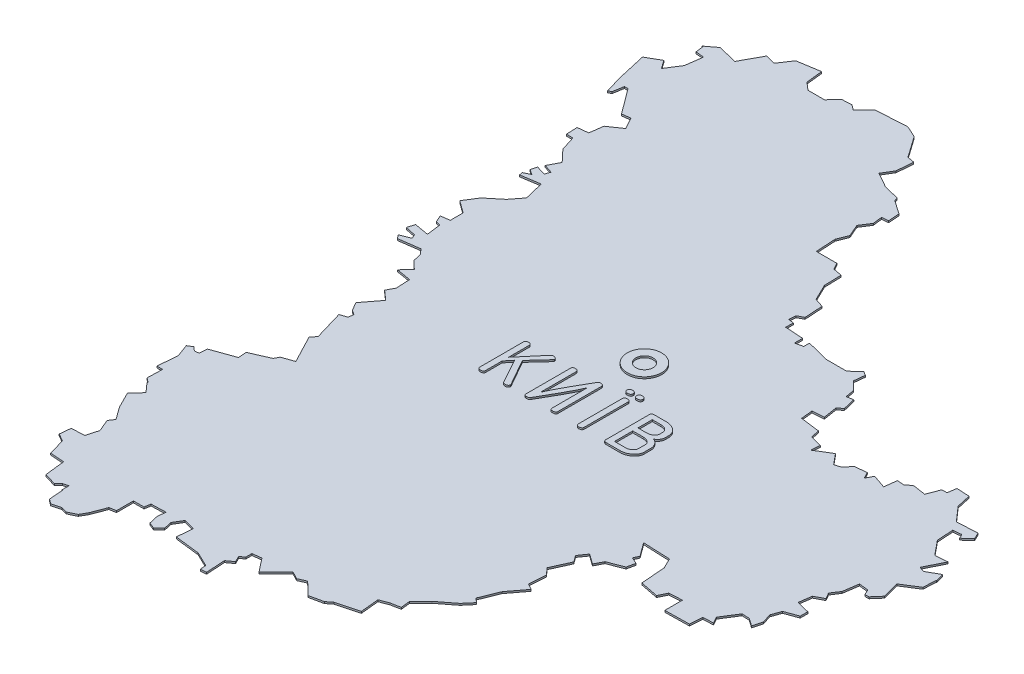
from build123d import *

# Parameters (mm, degrees)
EXTRUDE_1_DEPTH = 5
SKETCH_2_R      = 50
SKETCH_2_R_2    = 25
EXTRUDE_2_DEPTH = 10
SCALE_1_SCALE   = 0.05


with BuildPart() as part:
    # Эскиз1 → Бобышка-Вытянуть1 (new body)
    with BuildSketch(Plane(origin=(0, 0, 0), x_dir=(1, 0, 0), z_dir=(0, 1, 0))):
        Polygon((1323.13934, 6150.00802), (1334.82842, 6150.00802), (1356.22538, 6174.66634), (1343.2409, 6223.34544), (1389.35968, 6252.55036), (1391.26722, 6290.18808), (1392.61342, 6290.18808), (1386.05768, 6313.54592), (1350.40624, 6293.45198), (1334.82842, 6298.62596), (1362.06992, 6353.13944), (1326.39308, 6349.8984), (1292.01164, 6392.06748), (1288.7579, 6440.08618), (1312.77106, 6442.05722), (1319.25314, 6429.7179), (1341.96836, 6450.47732), (1332.89802, 6469.29618), (1273.15722, 6466.05514), (1236.18498, 6508.2293), (1227.1121, 6549.11568), (1190.08906, 6551.04608), (1186.20032, 6525.76038), (1171.28544, 6525.76038), (1157.66342, 6489.4333), (1125.24032, 6494.60982), (1118.10038, 6494.60982), (1104.4555, 6482.92582), (1083.66814, 6484.23138), (1079.1698, 6448.54946), (1039.55596, 6462.15116), (1029.16228, 6442.05722), (1019.429, 6460.85322), (985.0755, 6456.96956), (968.17688, 6436.84514), (950.64326, 6431.65338), (925.3347, 6462.15116), (880.55958, 6434.90458), (882.48998, 6460.85322), (848.77148, 6469.29618), (843.58734, 6494.60982), (787.12568, 6501.74468), (783.87194, 6535.48096), (817.61838, 6537.4393), (811.08804, 6578.3206), (824.78372, 6588.71428), (816.34584, 6624.39366), (797.51682, 6621.15516), (792.30728, 6648.40174), (768.29412, 6672.39966), (771.54786, 6702.90506), (759.85878, 6710.06532), (733.88982, 6686.03946), (672.90188, 6686.03946), (609.32568, 6702.90506), (609.32568, 6686.03946), (587.24292, 6680.85024), (587.24292, 6704.85324), (534.69286, 6708.09682), (534.69286, 6730.1618), (519.11758, 6732.1049), (521.07338, 6752.2344), (537.9212, 6761.3022), (534.69286, 6813.87004), (508.7239, 6822.31046), (485.37114, 6870.32408), (484.07574, 6919.66358), (458.10424, 6924.86296), (447.7131, 6943.67166), (388.0231, 6943.67166), (384.79476, 7001.41602), (397.11884, 7032.57674), (381.54356, 7068.2612), (400.37258, 7097.45596), (397.11884, 7124.73302), (415.92246, 7126.02334), (413.99206, 7158.46676), (374.40108, 7185.71842), (371.14988, 7196.09686), (327.0377, 7206.488), (282.26258, 7231.7864), (301.0662, 7262.94458), (304.95494, 7310.3232), (284.19298, 7314.2094), (241.3508, 7375.2075), (207.6069, 7390.78278), (118.7196, 7385.58594), (86.29396, 7353.1476), (70.69328, 7364.82652), (42.13098, 7363.50826), (18.11782, 7337.57232), (-29.8831, 7337.57232), (-51.94046, 7356.3861), (-57.15, 7404.4175), (-122.02414, 7394.0162), (-147.3327, 7356.3861), (-176.53, 7363.50826), (-209.0039, 7303.83858), (-265.4427, 7317.4606), (-294.63746, 7295.39562), (-295.3004, 7294.73268), (-292.70706, 7295.39562), (-289.45586, 7271.39008), (-265.4427, 7269.42666), (-271.94764, 7220.09986), (-297.8912, 7179.23888), (-314.76442, 7203.24696), (-354.35286, 7180.52666), (-335.52384, 7097.45596), (-319.94856, 7044.26582), (-311.51068, 7049.44742), (-306.32654, 7079.94266), (-295.9354, 7079.94266), (-241.427, 7006.62556), (-217.43924, 7009.87676), (-198.61022, 6976.10492), (-236.2454, 6950.18676), (-241.427, 6911.22316), (-271.94764, 6907.96434), (-270.6243, 6875.53108), (-251.82068, 6875.53108), (-238.2012, 6832.70668), (-205.7527, 6798.28206), (-222.62338, 6765.86912), (-197.31482, 6757.42616), (-202.49896, 6742.49604), (-229.76586, 6750.9263), (-234.31246, 6733.41046), (-219.37218, 6723.67718), (-238.2012, 6714.59922), (-236.2454, 6704.85324), (-181.73954, 6713.2962), (-168.11752, 6656.83962), (-193.42608, 6624.39366), (-234.31246, 6590.64722), (-258.30022, 6553.01204), (-222.62338, 6527.04308), (-222.62338, 6489.4333), (-248.56948, 6486.17194), (-239.4966, 6466.05514), (-225.85172, 6462.15116), (-220.66758, 6421.2851), (-262.21436, 6428.39456), (-268.6939, 6407.6326), (-238.2012, 6401.16576), (-232.99166, 6388.8239), (-262.21436, 6377.16022), (-253.11608, 6366.76908), (-193.42608, 6375.20696), (-179.7812, 6359.63676), (-174.59706, 6336.26368), (-151.2443, 6313.54592), (-174.59706, 6288.25006), (-132.41528, 6281.11012), (-130.48488, 6240.2212), (-142.14856, 6218.15876), (-114.90706, 6194.14814), (-152.51684, 6144.82388), (-137.62482, 6119.51786), (-125.30074, 6112.38554), (-127.23114, 6096.81026), (-147.3327, 6090.32056), (-122.02414, 6004.6489), (-133.71068, 5989.73402), (-91.5543, 5909.26428), (-125.30074, 5897.57774), (-132.41528, 5883.95318), (-186.94654, 5859.95018), (-184.99074, 5835.93702), (-251.82068, 5811.9137), (-253.11608, 5789.8538), (-265.4427, 5787.91578), (-277.12924, 5798.29676), (-290.75126, 5789.8538), (-277.12924, 5752.21608), (-282.31338, 5695.76712), (-265.4427, 5695.76712), (-266.7381, 5651.62954), (-253.11608, 5641.26126), (-255.70942, 5640.62626), (-231.06126, 5612.69896), (-257.00482, 5584.79706), (-232.99166, 5537.40574), (-207.0481, 5501.73144), (-217.43924, 5486.15362), (-202.49896, 5450.45138), (-212.23224, 5416.06994), (-249.89028, 5414.11414), (-253.11608, 5382.32604), (-231.06126, 5369.99942), (-217.43924, 5321.9731), (-176.53, 5318.7219), (-174.59706, 5298.62288), (-170.07586, 5260.9877), (-135.66902, 5250.59656), (-123.97994, 5262.2577), (-108.40212, 5266.14644), (-108.40212, 5245.38702), (-106.47172, 5245.38702), (-103.21798, 5204.52604), (-89.5731, 5194.13236), (-63.60414, 5201.2723), (-46.78172, 5196.08816), (-22.74316, 5207.75184), (-11.05408, 5228.5392), (4.49834, 5269.40018), (23.32736, 5272.65138), (23.32736, 5321.9731), (53.82006, 5321.9731), (57.07126, 5339.50672), (99.89058, 5340.77926), (96.66224, 5318.7219), (103.14178, 5290.185), (120.6754, 5283.01966), (137.54862, 5298.62288), (132.33908, 5321.9731), (147.9169, 5347.9446), (180.3654, 5339.50672), (176.47666, 5293.43874), (248.49074, 5285.00086), (291.33546, 5264.24144), (292.63086, 5247.34282), (309.50408, 5248.63822), (306.27574, 5303.80448), (325.07936, 5317.4265), (316.64402, 5334.29972), (328.3331, 5344.69086), (328.3331, 5361.53868), (354.30206, 5364.81782), (384.79476, 5325.88724), (434.09108, 5375.20896), (456.80884, 5363.49448), (478.8916, 5373.25316), (515.86384, 5337.52552), (554.81982, 5345.98626), (570.3697, 5358.31288), (633.33884, 5375.20896), (628.1293, 5428.39402), (654.09826, 5438.1273), (681.33976, 5443.33684), (678.11142, 5470.5758), (710.58786, 5503.02684), (756.63044, 5538.72908), (778.6878, 5564.67264), (766.33832, 5575.06632), (788.39568, 5629.57218), (824.78372, 5677.5731), (807.2755, 5687.30638), (811.08804, 5735.35302), (793.60522, 5755.45966), (817.61838, 5808.69298), (804.02176, 5827.48898), (820.86958, 5851.50976), (850.09228, 5830.74272), (862.41636, 5854.74318), (906.52854, 5871.61386), (911.73808, 5895.64226), (892.88366, 5904.07506), (899.3886, 5919.65542), (870.82884, 5958.60378), (949.34786, 5955.33988), (964.28814, 5924.8294), (969.47228, 5854.74318), (1022.65734, 5844.37236), (1034.39722, 5868.3906), (1072.02986, 5870.33624), (1072.02986, 5819.05872), (1142.08814, 5820.35666), (1145.31394, 5856.7066), (1174.53664, 5857.99438), (1164.1455, 5876.82848), (1193.34026, 5922.89138), (1215.44842, 5921.58328), (1237.48038, 5906.02578), (1244.64572, 5933.2749), (1236.18498, 5960.5418), (1245.89032, 5987.78584), (1283.5509, 6001.41548), (1283.5509, 6023.48046), (1245.89032, 6032.55842), (1251.09986, 6069.54082), (1277.04342, 6083.18062), (1266.70308, 6100.71932), (1282.25296, 6124.7274), (1288.7579, 6168.84212), (1316.0248, 6165.596), align=None)
    extrude(amount=EXTRUDE_1_DEPTH)

    # Эскиз2 → Бобышка-Вытянуть2 (add)
    # profile 1 of 7: a face of its own
    with BuildSketch(Plane(origin=(0, 0, 0), x_dir=(1, 0, 0), z_dir=(0, 1, 0))):
        with Locations((423.771289097, 6408.067162755)):
            Circle(SKETCH_2_R)
        with Locations((423.771289097, 6408.067162755)):
            Circle(SKETCH_2_R_2, mode=Mode.SUBTRACT)
    # profile 2 of 7: a face of its own
    with BuildSketch(Plane(origin=(0, 0, 0), x_dir=(1, 0, 0), z_dir=(0, 1, 0))):
        with BuildLine():
            Line((212.100996902, 6205.640563709), (212.100996902, 6158.165901547))
            add(Edge.make_bspline(
                [(212.100996902, 6158.165901547), (212.076151037, 6157.630130272), (212.028702129, 6156.606951506), (211.570733248, 6155.176310008), (210.823160978, 6153.95011345), (209.727178033, 6152.985301335), (208.3770608, 6152.204739616), (206.713722067, 6151.685071424), (204.769287254, 6151.410763775), (203.381465112, 6151.362882504), (202.641537443, 6151.337354249)],
                knots=[0, 0, 0, 0, 0.966526808, 1.845805764, 2.686487088, 3.531690263, 4.457941251, 5.489333743, 6.661419661, 8, 8, 8, 8], degree=3))
            add(Edge.make_bspline(
                [(202.641537443, 6151.337354249), (202.049390358, 6151.363162041), (200.935803217, 6151.411695972), (199.368110983, 6151.685685858), (198.039454345, 6152.222993338), (196.940831304, 6152.973129919), (196.076068853, 6153.954096971), (195.49620751, 6155.162107707), (195.127098661, 6156.567866292), (195.092430479, 6157.572055214), (195.073969875, 6158.106779925)],
                knots=[0, 0, 0, 0, 1.22289028, 2.299757822, 3.266537475, 4.157864275, 5.022578284, 5.932048079, 6.898827733, 8, 8, 8, 8], degree=3))
            Line((195.073969875, 6158.106779925), (195.073969875, 6284.567928574))
            add(Edge.make_bspline(
                [(195.073969875, 6284.567928574), (195.092430479, 6285.102653284), (195.127098661, 6286.106842207), (195.49620751, 6287.512600792), (196.076068853, 6288.720611528), (196.940831304, 6289.701578579), (198.039454345, 6290.451715161), (199.368110983, 6290.989022641), (200.935803217, 6291.263012527), (202.049390358, 6291.311546457), (202.641537443, 6291.337354249)],
                knots=[0, 0, 0, 0, 1.101172267, 2.067951921, 2.977421716, 3.842135725, 4.733462525, 5.700242178, 6.77710972, 8, 8, 8, 8], degree=3))
            add(Edge.make_bspline(
                [(202.641537443, 6291.337354249), (203.381103556, 6291.311191), (204.768247555, 6291.262118723), (206.717109001, 6290.995585475), (208.357352893, 6290.454385614), (209.744095686, 6289.758227886), (210.810970457, 6288.782939572), (211.572351704, 6287.591050264), (212.028341152, 6286.185989365), (212.076019574, 6285.182375115), (212.100996902, 6284.656611006)],
                knots=[0, 0, 0, 0, 1.349898262, 2.531894363, 3.572007453, 4.488635547, 5.340985057, 6.173587819, 7.043196157, 8, 8, 8, 8], degree=3))
            Line((212.100996902, 6284.656611006), (212.100996902, 6224.234313709))
            Line((212.100996902, 6224.234313709), (268.207415821, 6290.509651547))
            add(Edge.make_bspline(
                [(268.207415821, 6290.509651547), (268.614488581, 6290.923876385), (269.416229371, 6291.739703388), (270.906877501, 6292.611583145), (272.578211618, 6293.129595801), (273.751186942, 6293.195342181), (274.35606447, 6293.229246141)],
                knots=[0, 0, 0, 0, 1.001638502, 1.972754074, 2.954593947, 4, 4, 4, 4], degree=3))
            add(Edge.make_bspline(
                [(274.35606447, 6293.229246141), (275.029052882, 6293.20325954), (276.341249035, 6293.152590737), (278.214699392, 6292.689295054), (279.954093924, 6291.985754903), (281.436137429, 6290.948787941), (282.699693437, 6289.830503342), (283.626369837, 6288.673994946), (284.274717756, 6287.51652025), (284.343876896, 6286.703508673), (284.377179335, 6286.312016412)],
                knots=[0, 0, 0, 0, 1.21950062, 2.377788377, 3.483948434, 4.605045631, 5.643332121, 6.534384309, 7.294257033, 8, 8, 8, 8], degree=3))
            add(Edge.make_bspline(
                [(284.377179335, 6286.312016412), (284.288442316, 6285.698589957), (284.095398051, 6284.36410227), (283.203624345, 6283.34495426), (282.721773929, 6282.794279925)],
                knots=[0, 0, 0, 0, 0.919343747, 2, 2, 2, 2], degree=3))
            Line((282.721773929, 6282.794279925), (240.302010416, 6236.590732628))
            Line((240.302010416, 6236.590732628), (283.165186091, 6161.121982628))
            add(Edge.make_bspline(
                [(283.165186091, 6161.121982628), (283.485550423, 6160.545152222), (284.037455072, 6159.551423046), (284.19347931, 6158.429609726), (284.258936091, 6157.958975871)],
                knots=[0, 0, 0, 0, 1.160940868, 2, 2, 2, 2], degree=3))
            add(Edge.make_bspline(
                [(284.258936091, 6157.958975871), (284.234595257, 6157.443160709), (284.187561467, 6156.446451194), (283.71064667, 6155.045588383), (282.86342853, 6153.886358729), (281.751463934, 6152.915054274), (280.289774247, 6152.209266734), (278.546631297, 6151.682591099), (276.482570232, 6151.412381991), (275.016865592, 6151.363392768), (274.237821227, 6151.337354249)],
                knots=[0, 0, 0, 0, 0.908999758, 1.756460018, 2.56759263, 3.418796028, 4.337074916, 5.410419897, 6.623598691, 8, 8, 8, 8], degree=3))
            add(Edge.make_bspline(
                [(274.237821227, 6151.337354249), (273.534244662, 6151.365978734), (272.231010639, 6151.418999832), (270.453840762, 6151.935566921), (269.053833858, 6152.872628796), (268.50543111, 6153.766959525), (268.236976632, 6154.204752898)],
                knots=[0, 0, 0, 0, 1.200457517, 2.223606012, 3.130418436, 4, 4, 4, 4], degree=3))
            Line((268.236976632, 6154.204752898), (228.536807713, 6225.948840736))
            Line((228.536807713, 6225.948840736), (212.100996902, 6205.640563709))
        make_face()
    # profile 3 of 7: a face of its own
    with BuildSketch(Plane(origin=(0, 0, 0), x_dir=(1, 0, 0), z_dir=(0, 1, 0))):
        with BuildLine():
            add(Edge.make_bspline(
                [(420.587483389, 6159.969111006), (420.561164492, 6159.4437072), (420.510454683, 6158.431387916), (420.065824983, 6157.012999699), (419.297951191, 6155.811422301), (418.222933333, 6154.842511655), (416.853364877, 6154.10439863), (415.201978809, 6153.574000663), (413.255230319, 6153.303565123), (411.867762623, 6153.25509066), (411.128023929, 6153.229246141)],
                knots=[0, 0, 0, 0, 0.953740082, 1.837614163, 2.667550865, 3.517171085, 4.439430397, 5.476212962, 6.654424219, 8, 8, 8, 8], degree=3))
            add(Edge.make_bspline(
                [(411.128023929, 6153.229246141), (410.535886071, 6153.255058462), (409.422316283, 6153.30360091), (407.854509644, 6153.57753464), (406.526224421, 6154.115024432), (405.426359207, 6154.864551281), (404.57195537, 6155.8410367), (403.975206825, 6157.030396449), (403.617618998, 6158.421362706), (403.580205567, 6159.415029318), (403.560456362, 6159.939550195)],
                knots=[0, 0, 0, 0, 1.228791976, 2.310856505, 3.282301858, 4.177930221, 5.04681736, 5.942445723, 6.913891076, 8, 8, 8, 8], degree=3))
            Line((403.560456362, 6159.939550195), (403.560456362, 6261.717421817))
            add(Edge.make_bspline(
                [(403.560456362, 6261.717421817), (403.033910823, 6260.483268572), (401.920746483, 6257.874158281), (400.039323907, 6253.79273387), (397.926534894, 6249.311256353), (395.511007167, 6244.453376438), (392.858342494, 6239.197255452), (389.930010163, 6233.551665946), (386.729151179, 6227.530768057), (383.305363082, 6221.092625987), (379.569388631, 6214.290700867), (375.633811496, 6207.062506883), (371.333775671, 6199.500447731), (366.877344885, 6191.492784135), (362.102448663, 6183.125858504), (357.070573033, 6174.369752859), (351.788168305, 6165.210494191), (348.156243694, 6158.982241078), (346.301165821, 6155.801036682)],
                knots=[0, 0, 0, 0, 0.534634628, 1.1302654, 1.790641929, 2.508823085, 3.291972686, 4.136661157, 5.042962484, 6.009079317, 7.042220393, 8.135217324, 9.288472575, 10.508460132, 11.78685178, 13.127093989, 14.532606002, 16, 16, 16, 16], degree=3))
            add(Edge.make_bspline(
                [(346.301165821, 6155.801036682), (345.84906249, 6155.11283426), (344.950095667, 6153.744405624), (342.816912935, 6152.323628558), (340.220878932, 6151.440139488), (338.308516205, 6151.373184889), (337.285118524, 6151.337354249)],
                knots=[0, 0, 0, 0, 0.92554952, 1.840371998, 2.844278725, 4, 4, 4, 4], degree=3))
            add(Edge.make_bspline(
                [(337.285118524, 6151.337354249), (336.691670776, 6151.355907263), (335.581164805, 6151.390625117), (334.027185181, 6151.753534445), (332.711702957, 6152.33381325), (331.616288619, 6153.167113216), (330.787646736, 6154.253767325), (330.180299256, 6155.573338131), (329.837134396, 6157.123930124), (329.797503896, 6158.233176648), (329.776672578, 6158.816239384)],
                knots=[0, 0, 0, 0, 1.171630376, 2.192446653, 3.134147218, 3.995415972, 4.884019595, 5.808017826, 6.847809664, 8, 8, 8, 8], degree=3))
            Line((329.776672578, 6158.816239384), (329.776672578, 6286.430259655))
            add(Edge.make_bspline(
                [(329.776672578, 6286.430259655), (329.797058255, 6286.964268072), (329.835706174, 6287.976660972), (330.183636085, 6289.391852116), (330.797901582, 6290.58947479), (331.631224018, 6291.593977027), (332.743946679, 6292.342211722), (334.070259446, 6292.88134666), (335.638673653, 6293.154773642), (336.752151289, 6293.20339295), (337.344240145, 6293.229246141)],
                knots=[0, 0, 0, 0, 1.098843442, 2.08322802, 2.972669788, 3.850929026, 4.740370794, 5.705105844, 6.779695961, 8, 8, 8, 8], degree=3))
            add(Edge.make_bspline(
                [(337.344240145, 6293.229246141), (338.083919865, 6293.203338844), (339.471276945, 6293.154746634), (341.418747483, 6292.885079703), (343.067860681, 6292.352262295), (344.450600972, 6291.61863933), (345.50496989, 6290.617301), (346.283590455, 6289.417599704), (346.729232214, 6287.98755801), (346.778107066, 6286.965463287), (346.803699605, 6286.430259655)],
                knots=[0, 0, 0, 0, 1.340544031, 2.514349394, 3.547254935, 4.466065479, 5.324653274, 6.151486447, 7.032055301, 8, 8, 8, 8], degree=3))
            Line((346.803699605, 6286.430259655), (346.803699605, 6182.849178574))
            add(Edge.make_bspline(
                [(346.803699605, 6182.849178574), (347.320526975, 6184.083217194), (348.413244475, 6186.692319719), (350.255925546, 6190.768433224), (352.364889561, 6195.237593383), (354.715998547, 6200.102693985), (357.367471483, 6205.344783143), (360.254702756, 6210.986265505), (363.430977027, 6217.019793058), (366.842685161, 6223.453815337), (370.558695517, 6230.261381777), (374.507837822, 6237.471064455), (378.745348153, 6245.057059097), (383.198015109, 6253.055815741), (387.966051887, 6261.411206554), (392.997988373, 6270.167279425), (398.280375923, 6279.326547345), (401.912302936, 6285.554799163), (403.767382037, 6288.736002898)],
                knots=[0, 0, 0, 0, 0.533796669, 1.128595342, 1.784614138, 2.505550971, 3.284458494, 4.128465136, 5.034135491, 6.005002577, 7.034180805, 8.12862722, 9.284923427, 10.501177496, 11.78126449, 13.123284068, 14.53066001, 16, 16, 16, 16], degree=3))
            add(Edge.make_bspline(
                [(403.767382037, 6288.736002898), (404.192389427, 6289.428544738), (405.005072385, 6290.752796889), (406.817192954, 6292.180125393), (408.895952686, 6293.110423143), (410.408230376, 6293.18885101), (411.187145551, 6293.229246141)],
                knots=[0, 0, 0, 0, 1.059650509, 2.02622338, 2.98338475, 4, 4, 4, 4], degree=3))
            add(Edge.make_bspline(
                [(411.187145551, 6293.229246141), (411.928327268, 6293.211759583), (413.312092494, 6293.179112674), (415.238112364, 6292.80847127), (416.902134914, 6292.277832869), (418.258874408, 6291.441191103), (419.311384004, 6290.361597463), (420.066302338, 6289.054645656), (420.515623909, 6287.503235336), (420.562685455, 6286.393978479), (420.587483389, 6285.809482628)],
                knots=[0, 0, 0, 0, 1.29965344, 2.426416082, 3.433331493, 4.350449838, 5.194812866, 6.055508021, 6.975397369, 8, 8, 8, 8], degree=3))
            Line((420.587483389, 6285.809482628), (420.587483389, 6159.969111006))
        make_face()
    # profile 4 of 7: a face of its own
    with BuildSketch(Plane(origin=(0, 0, 0), x_dir=(1, 0, 0), z_dir=(0, 1, 0))):
        with BuildLine():
            add(Edge.make_bspline(
                [(467.02160501, 6314.040056952), (467.039110958, 6314.633491471), (467.072221023, 6315.755890344), (467.456463581, 6317.329660328), (468.116127381, 6318.660860146), (469.026028707, 6319.7704453), (470.215993612, 6320.605359891), (471.646726189, 6321.201553852), (473.331091282, 6321.551135526), (474.538145173, 6321.588006424), (475.180388794, 6321.60762452)],
                knots=[0, 0, 0, 0, 1.115458338, 2.109734338, 3.022263655, 3.891534895, 4.782118321, 5.729611698, 6.79198235, 8, 8, 8, 8], degree=3))
            add(Edge.make_bspline(
                [(475.180388794, 6321.60762452), (475.960484813, 6321.588221739), (477.431272935, 6321.55163986), (479.49132336, 6321.197225804), (481.256545986, 6320.633388286), (482.702122333, 6319.784051194), (483.833238418, 6318.692281125), (484.652806765, 6317.353784238), (485.135930712, 6315.766884403), (485.178920585, 6314.634769761), (485.201503659, 6314.040056952)],
                knots=[0, 0, 0, 0, 1.307446989, 2.465052319, 3.494757347, 4.399019533, 5.252295706, 6.105571879, 7.004835174, 8, 8, 8, 8], degree=3))
            add(Edge.make_bspline(
                [(485.201503659, 6314.040056952), (485.178920585, 6313.445344143), (485.135930712, 6312.313229501), (484.652806765, 6310.726329666), (483.833238418, 6309.387832779), (482.702122333, 6308.29606271), (481.256545986, 6307.446725618), (479.49132336, 6306.8828881), (477.431272935, 6306.528474044), (475.960484813, 6306.491892165), (475.180388794, 6306.472489384)],
                knots=[0, 0, 0, 0, 0.995164826, 1.894428121, 2.747704294, 3.600980467, 4.505242653, 5.534947681, 6.692553011, 8, 8, 8, 8], degree=3))
            add(Edge.make_bspline(
                [(475.180388794, 6306.472489384), (474.538145173, 6306.49210748), (473.331091282, 6306.528978378), (471.646726189, 6306.878560052), (470.215993612, 6307.474754013), (469.026028707, 6308.309668605), (468.116127381, 6309.419253758), (467.456463581, 6310.750453576), (467.072221023, 6312.32422356), (467.039110958, 6313.446622433), (467.02160501, 6314.040056952)],
                knots=[0, 0, 0, 0, 1.20801765, 2.270388302, 3.217881679, 4.108465105, 4.977736345, 5.890265662, 6.884541662, 8, 8, 8, 8], degree=3))
        make_face()
    # profile 5 of 7: a face of its own
    with BuildSketch(Plane(origin=(0, 0, 0), x_dir=(1, 0, 0), z_dir=(0, 1, 0))):
        with BuildLine():
            add(Edge.make_bspline(
                [(495.252179335, 6314.040056952), (495.269655166, 6314.63353636), (495.30270827, 6315.756020134), (495.687332225, 6317.329221638), (496.345715162, 6318.662330612), (497.255005738, 6319.758984095), (498.426292255, 6320.622814516), (499.871752316, 6321.192883317), (501.550956167, 6321.551139458), (502.748713232, 6321.588100601), (503.381402308, 6321.60762452)],
                knots=[0, 0, 0, 0, 1.117752497, 2.114073421, 3.028479535, 3.899538602, 4.77692123, 5.743494502, 6.808050129, 8, 8, 8, 8], degree=3))
            add(Edge.make_bspline(
                [(503.381402308, 6321.60762452), (504.161498327, 6321.588221739), (505.632286449, 6321.55163986), (507.692336873, 6321.197225804), (509.4575595, 6320.633388286), (510.903135847, 6319.784051194), (512.034251932, 6318.692281125), (512.853820279, 6317.353784238), (513.336944225, 6315.766884403), (513.379934099, 6314.634769761), (513.402517172, 6314.040056952)],
                knots=[0, 0, 0, 0, 1.307446989, 2.465052319, 3.494757347, 4.399019533, 5.252295706, 6.105571879, 7.004835174, 8, 8, 8, 8], degree=3))
            add(Edge.make_bspline(
                [(513.402517172, 6314.040056952), (513.379934099, 6313.445344143), (513.336944225, 6312.313229501), (512.853820279, 6310.726329666), (512.034251932, 6309.387832779), (510.903135847, 6308.29606271), (509.4575595, 6307.446725618), (507.692336873, 6306.8828881), (505.632286449, 6306.528474044), (504.161498327, 6306.491892165), (503.381402308, 6306.472489384)],
                knots=[0, 0, 0, 0, 0.995164826, 1.894428121, 2.747704294, 3.600980467, 4.505242653, 5.534947681, 6.692553011, 8, 8, 8, 8], degree=3))
            add(Edge.make_bspline(
                [(503.381402308, 6306.472489384), (502.748713232, 6306.492013303), (501.550956167, 6306.528974447), (499.871752316, 6306.887230587), (498.426292255, 6307.457299388), (497.255005738, 6308.321129809), (496.345715162, 6309.417783293), (495.687332225, 6310.750892266), (495.30270827, 6312.32409377), (495.269655166, 6313.446577544), (495.252179335, 6314.040056952)],
                knots=[0, 0, 0, 0, 1.191949871, 2.256505498, 3.22307877, 4.100461398, 4.971520465, 5.885926579, 6.882247503, 8, 8, 8, 8], degree=3))
        make_face()
    # profile 6 of 7: a face of its own
    with BuildSketch(Plane(origin=(0, 0, 0), x_dir=(1, 0, 0), z_dir=(0, 1, 0))):
        with BuildLine():
            add(Edge.make_bspline(
                [(498.533429335, 6158.136340736), (498.508020227, 6157.600920536), (498.459495678, 6156.578412228), (498.011456251, 6155.151201336), (497.244984659, 6153.947185408), (496.160891099, 6152.984515019), (494.80909362, 6152.20498498), (493.146282347, 6151.684992925), (491.20168044, 6151.410787872), (489.813883897, 6151.362890884), (489.073969875, 6151.337354249)],
                knots=[0, 0, 0, 0, 0.968349646, 1.849286893, 2.676465977, 3.523263178, 4.451261044, 5.484598709, 6.658895142, 8, 8, 8, 8], degree=3))
            add(Edge.make_bspline(
                [(489.073969875, 6151.337354249), (488.481661061, 6151.362925637), (487.367769773, 6151.411014988), (485.802082811, 6151.687936032), (484.461568898, 6152.217841326), (483.381097616, 6153.005036179), (482.516935627, 6153.976861083), (481.915555099, 6155.176844307), (481.564788003, 6156.589319114), (481.526564249, 6157.602118113), (481.506402308, 6158.136340736)],
                knots=[0, 0, 0, 0, 1.220860227, 2.29594012, 3.261114875, 4.162696787, 5.025975332, 5.915822489, 6.900655729, 8, 8, 8, 8], degree=3))
            Line((481.506402308, 6158.136340736), (481.506402308, 6285.425192087))
            add(Edge.make_bspline(
                [(481.506402308, 6285.425192087), (481.526787984, 6285.959200505), (481.565435904, 6286.971593405), (481.913365814, 6288.386784549), (482.527631311, 6289.584407222), (483.360953748, 6290.588909459), (484.473676409, 6291.337144155), (485.799989175, 6291.876279093), (487.368403383, 6292.149706074), (488.481881019, 6292.198325382), (489.073969875, 6292.224178574)],
                knots=[0, 0, 0, 0, 1.098843442, 2.08322802, 2.972669788, 3.850929026, 4.740370794, 5.705105844, 6.779695961, 8, 8, 8, 8], degree=3))
            add(Edge.make_bspline(
                [(489.073969875, 6292.224178574), (489.813649594, 6292.198271276), (491.201006675, 6292.149679066), (493.148477212, 6291.880012136), (494.79759041, 6291.347194727), (496.180330702, 6290.613571763), (497.23469962, 6289.612233432), (498.013320185, 6288.412532136), (498.458961943, 6286.982490442), (498.507836796, 6285.96039572), (498.533429335, 6285.425192087)],
                knots=[0, 0, 0, 0, 1.340544031, 2.514349394, 3.547254935, 4.466065479, 5.324653274, 6.151486447, 7.032055301, 8, 8, 8, 8], degree=3))
            Line((498.533429335, 6285.425192087), (498.533429335, 6158.136340736))
        make_face()
    # profile 7 of 7: a face of its own
    with BuildSketch(Plane(origin=(0, 0, 0), x_dir=(1, 0, 0), z_dir=(0, 1, 0))):
        with BuildLine():
            add(Edge.make_bspline(
                [(569.030050956, 6151.337354249), (568.428336981, 6151.363776961), (567.295738061, 6151.41351211), (565.704882581, 6151.678935761), (564.366004249, 6152.232637254), (563.240927002, 6152.961425545), (562.381984723, 6153.962999435), (561.758593878, 6155.15284569), (561.400051844, 6156.569316501), (561.363632978, 6157.572559117), (561.344240145, 6158.106779925)],
                knots=[0, 0, 0, 0, 1.232960821, 2.320787205, 3.279617941, 4.180256019, 5.037860301, 5.949050899, 6.907881634, 8, 8, 8, 8], degree=3))
            Line((561.344240145, 6158.106779925), (561.344240145, 6284.567928574))
            add(Edge.make_bspline(
                [(561.344240145, 6284.567928574), (561.363630603, 6285.102155355), (561.400045008, 6286.105409189), (561.758616895, 6287.521804922), (562.381904863, 6288.711909904), (563.241212111, 6289.712565932), (564.372579365, 6290.450021276), (565.727310181, 6290.989347134), (567.324714371, 6291.262679218), (568.457695002, 6291.311446), (569.059611767, 6291.337354249)],
                knots=[0, 0, 0, 0, 1.089571855, 2.046166869, 2.955232828, 3.81083742, 4.709375465, 5.684624213, 6.769914095, 8, 8, 8, 8], degree=3))
            Line((569.059611767, 6291.337354249), (603.970929335, 6291.337354249))
            add(Edge.make_bspline(
                [(603.970929335, 6291.337354249), (605.302001253, 6291.30619454), (607.921374163, 6291.244876368), (611.772783693, 6290.843907469), (615.4554927, 6290.088411449), (618.983241235, 6289.081060164), (622.376374484, 6287.829353242), (625.5708852, 6286.201310396), (628.637491497, 6284.352485307), (631.468480131, 6282.188796661), (634.097569719, 6279.89424874), (636.361130841, 6277.421355733), (638.360671729, 6274.918113209), (639.915983863, 6272.25406068), (641.192884055, 6269.535187845), (642.032080418, 6266.692064806), (642.598549588, 6263.779643539), (642.66307938, 6261.798964447), (642.695591497, 6260.801036682)],
                knots=[0, 0, 0, 0, 1.171198757, 2.304763743, 3.401425581, 4.47439174, 5.530696579, 6.577530845, 7.624293311, 8.67678444, 9.708503523, 10.690046459, 11.62302617, 12.521073093, 13.397860953, 14.258992945, 15.122826465, 16, 16, 16, 16], degree=3))
            Line((642.695591497, 6260.801036682), (642.695591497, 6251.282455601))
            add(Edge.make_bspline(
                [(642.695591497, 6251.282455601), (642.658250937, 6250.13637102), (642.585242756, 6247.895548984), (641.940783994, 6244.633892681), (640.911454532, 6241.564686164), (639.43742524, 6238.692662751), (637.554757068, 6236.009603035), (635.249562402, 6233.518707029), (632.552633337, 6231.188451078), (630.504868837, 6229.875412355), (629.452348254, 6229.200529925)],
                knots=[0, 0, 0, 0, 1.016943448, 1.98832558, 2.940278107, 3.883462277, 4.844820293, 5.841993235, 6.890816527, 8, 8, 8, 8], degree=3))
            add(Edge.make_bspline(
                [(629.452348254, 6229.200529925), (630.74318173, 6228.647991239), (633.329972257, 6227.540720732), (636.891994019, 6225.155283932), (640.09286511, 6222.150376253), (642.94697683, 6218.683280532), (645.325448955, 6214.881894687), (647.10571943, 6210.914328603), (648.152595183, 6206.807228155), (648.298319792, 6204.040100926), (648.371267172, 6202.654921817)],
                knots=[0, 0, 0, 0, 0.975514552, 1.954901115, 2.964124007, 4.021152463, 5.071398447, 6.075319989, 7.036536335, 8, 8, 8, 8], degree=3))
            Line((648.371267172, 6202.654921817), (648.371267172, 6182.878739384))
            add(Edge.make_bspline(
                [(648.371267172, 6182.878739384), (648.33644784, 6181.891303039), (648.266997031, 6179.921757749), (647.727699839, 6177.004407844), (646.782378838, 6174.180850222), (645.544323573, 6171.399296259), (643.891213154, 6168.70817914), (641.908113354, 6166.06946052), (639.545830598, 6163.521984358), (636.884156341, 6161.075479291), (634.001918272, 6158.776680692), (630.90840989, 6156.803321675), (627.70736444, 6155.092444923), (624.342876013, 6153.736820072), (620.850383124, 6152.670760276), (617.230150085, 6151.908288711), (613.4836685, 6151.410243349), (610.939045865, 6151.361905537), (609.64660501, 6151.337354249)],
                knots=[0, 0, 0, 0, 0.861654758, 1.71866073, 2.578166397, 3.455855888, 4.370405889, 5.328567694, 6.332980831, 7.398161246, 8.482204407, 9.546273015, 10.596626481, 11.645993435, 12.707103149, 13.77999948, 14.872438165, 16, 16, 16, 16], degree=3))
            Line((609.64660501, 6151.337354249), (569.030050956, 6151.337354249))
        make_face()
        with BuildLine():
            Line((578.371267172, 6234.580597493), (604.030050956, 6234.580597493))
            add(Edge.make_bspline(
                [(604.030050956, 6234.580597493), (605.474756392, 6234.628462708), (608.298734193, 6234.722025246), (612.335101632, 6235.710324029), (616.075118902, 6237.219551822), (619.342337074, 6239.3709001), (622.142426661, 6241.851770657), (624.1613226, 6244.670364388), (625.464452031, 6247.707584958), (625.600313525, 6249.831301574), (625.66856447, 6250.89816506)],
                knots=[0, 0, 0, 0, 1.157838163, 2.263235943, 3.316732326, 4.381105629, 5.389115299, 6.302412843, 7.147205546, 8, 8, 8, 8], degree=3))
            Line((625.66856447, 6250.89816506), (625.66856447, 6259.973333979))
            add(Edge.make_bspline(
                [(625.66856447, 6259.973333979), (625.601083407, 6261.03066103), (625.465893868, 6263.14887836), (624.140701694, 6266.156962254), (622.093016799, 6268.934758782), (619.316160741, 6271.416724209), (616.037284858, 6273.553297834), (612.326224173, 6275.114079749), (608.284073009, 6276.051521832), (605.473802672, 6276.151074701), (604.030050956, 6276.202219114)],
                knots=[0, 0, 0, 0, 0.847498087, 1.69785227, 2.60103633, 3.612096725, 4.679691338, 5.739440999, 6.838657658, 8, 8, 8, 8], degree=3))
            Line((604.030050956, 6276.202219114), (578.371267172, 6276.202219114))
            Line((578.371267172, 6276.202219114), (578.371267172, 6234.580597493))
        make_face(mode=Mode.SUBTRACT)
        with BuildLine():
            Line((578.371267172, 6166.472489384), (609.705726632, 6166.472489384))
            add(Edge.make_bspline(
                [(609.705726632, 6166.472489384), (611.16992549, 6166.531485154), (614.002943872, 6166.645633653), (618.069600087, 6167.628654115), (621.798169247, 6169.194603307), (625.076324239, 6171.40822259), (627.811265021, 6174.024235392), (629.876735142, 6176.944056614), (631.132177055, 6180.161613382), (631.273459261, 6182.405109506), (631.344240145, 6183.529077222)],
                knots=[0, 0, 0, 0, 1.151408267, 2.227812683, 3.274044775, 4.319816504, 5.323890745, 6.23852516, 7.117519824, 8, 8, 8, 8], degree=3))
            Line((631.344240145, 6183.529077222), (631.344240145, 6202.477556952))
            add(Edge.make_bspline(
                [(631.344240145, 6202.477556952), (631.275000261, 6203.602163093), (631.137363157, 6205.837688686), (629.866467517, 6209.037723798), (627.820036509, 6211.960855334), (625.045730949, 6214.534080888), (621.753943149, 6216.71175857), (618.052651863, 6218.337153004), (613.977198285, 6219.257140424), (611.158785152, 6219.381399474), (609.705726632, 6219.445462357)],
                knots=[0, 0, 0, 0, 0.884441195, 1.758118558, 2.674785444, 3.681331205, 4.725120366, 5.776757677, 6.853787204, 8, 8, 8, 8], degree=3))
            Line((609.705726632, 6219.445462357), (578.371267172, 6219.445462357))
            Line((578.371267172, 6219.445462357), (578.371267172, 6166.472489384))
        make_face(mode=Mode.SUBTRACT)
    extrude(amount=EXTRUDE_2_DEPTH)


with BuildPart() as part_1:
    # Масштаб1: scaled about (352.119365371, 2.563133094, -6249.821761567)
    add(part.part.scale(SCALE_1_SCALE).moved(Location((334.513397102, 2.434976439, -5937.330673489))))


solid = part_1.part
